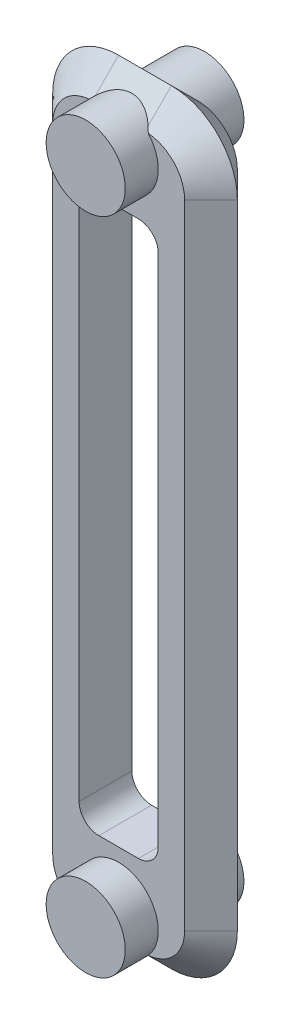
from build123d import *

# Parameters (mm, degrees)
EXTRUDE_1_DEPTH      = 20
EXTRUDE_1_DEPTH_BACK = 20
SKETCH_1_W           = 140
SKETCH_1_H           = 580
SKETCH_1_R           = 30
EXTRUDE_2_DEPTH      = 25
EXTRUDE_2_DEPTH_BACK = 65
SKETCH_3_R           = 30
CUT_EXTRUDE_1_DEPTH  = 40
FILLET_1_R           = 50
FILLET_2_R           = 15
CHAMFER_1_SIZE       = 20


with BuildPart() as part:
    # Эскиз1 → Бобышка-Вытянуть1 (new, two sides: drawn at the far end of the back side and taken through both)
    with BuildSketch(Plane.XY.offset(-EXTRUDE_1_DEPTH_BACK)):
        with Locations((0, -208.783389553)):
            Rectangle(SKETCH_1_W, SKETCH_1_H)
        with Locations((0, 41.216610447)):
            Circle(SKETCH_1_R, mode=Mode.SUBTRACT)
        with Locations((0, -458.783389553)):
            Circle(SKETCH_1_R, mode=Mode.SUBTRACT)
    extrude(amount=EXTRUDE_1_DEPTH + EXTRUDE_1_DEPTH_BACK)

    # Эскиз3 → Бобышка-Вытянуть2 (add, two sides: drawn at the far end of the back side and taken through both)
    with BuildSketch(Plane(origin=(0, 0, -20), x_dir=(-1, 0, 0), z_dir=(0, 0, -1)).offset(-EXTRUDE_2_DEPTH_BACK)):
        with Locations((0, 41.216610447)):
            Circle(SKETCH_3_R)
        with Locations((0, -458.783389553)):
            Circle(SKETCH_3_R)
    extrude(amount=EXTRUDE_2_DEPTH + EXTRUDE_2_DEPTH_BACK)

    # Эскиз4 → Вырез-Вытянуть1 (cut)
    with BuildSketch(Plane(origin=(0, 0, -20), x_dir=(-1, 0, 0), z_dir=(0, 0, -1))):
        Polygon((-30, 1.216610447), (0, 1.216610447), (30, 1.216610447), (30, -418.783389553), (0, -418.783389553), (-30, -418.783389553), align=None)
    extrude(amount=-CUT_EXTRUDE_1_DEPTH, mode=Mode.SUBTRACT)

    # Скругление1
    fillet_1_edges = [part.edges().sort_by_distance(p)[0] for p in [
        (70, -498.783389553, 0),
        (70, 81.216610447, 0),
        (-70, 81.216610447, 0),
        (-70, -498.783389553, 0),
    ]]
    fillet(fillet_1_edges, radius=FILLET_1_R)

    # Скругление2
    fillet_2_edges = [part.edges().sort_by_distance(p)[0] for p in [
        (30, 1.216610447, 0),
        (-30, 1.216610447, 0),
        (-30, -418.783389553, 0),
        (30, -418.783389553, 0),
    ]]
    fillet(fillet_2_edges, radius=FILLET_2_R)

    # Фаска1
    # the kernel refuses this chamfer: 20 mm, written as the material it takes off along each edge
    with BuildSketch(Plane(origin=(20, -498.783389553, -20), x_dir=(0, -0.0274958766105877, 0.9996219169112968), z_dir=(-1, 0, 0))) as chamfer_1_piece_1_section:
        Polygon((CHAMFER_1_SIZE * 0.999621916911, CHAMFER_1_SIZE * 0.0274958766106), (-CHAMFER_1_SIZE * 0.0274958766106, CHAMFER_1_SIZE * 0.999621916911), (0, 0), align=None)
    chamfer_1_piece_1 = extrude(amount=40, mode=Mode.PRIVATE)
    chamfer_1_piece_1 = chamfer_1_piece_1 - Plane(origin=(0, -458.783389553, -12.567480213), x_dir=(-1, 0, 0), z_dir=(0, 0, 1)) * Cylinder(30, 160, mode=Mode.PRIVATE)
    add(chamfer_1_piece_1, mode=Mode.SUBTRACT)
    with BuildSketch(Plane(origin=(-20, -448.783389553, -20), x_dir=(0, -1, 0), z_dir=(1, 0, 0))) as chamfer_1_piece_2_section:
        Polygon((50, -CHAMFER_1_SIZE), (50 - CHAMFER_1_SIZE, 0), (50, 0), align=None)
    chamfer_1_piece_2 = revolve(axis=Axis((-20, -448.783389553, -20), (0, 0, -1)), revolution_arc=90, mode=Mode.PRIVATE)
    chamfer_1_piece_2 = chamfer_1_piece_2 - Plane(origin=(0, -458.783389553, -13.088521936), x_dir=(-1, 0, 0), z_dir=(0, 0, 1)) * Cylinder(30, 200, mode=Mode.PRIVATE)
    add(chamfer_1_piece_2, mode=Mode.SUBTRACT)
    with BuildSketch(Plane(origin=(20, -448.783389553, -20), x_dir=(1, 0, 0), z_dir=(0, 1, 0))) as chamfer_1_piece_3_section:
        Polygon((50, -CHAMFER_1_SIZE), (50 - CHAMFER_1_SIZE, 0), (50, 0), align=None)
    chamfer_1_piece_3 = revolve(axis=Axis((20, -448.783389553, -20), (0, 0, -1)), revolution_arc=90, mode=Mode.PRIVATE)
    chamfer_1_piece_3 = chamfer_1_piece_3 - Plane(origin=(0, -458.783389553, -13.088521936), x_dir=(-1, 0, 0), z_dir=(0, 0, 1)) * Cylinder(30, 200, mode=Mode.PRIVATE)
    add(chamfer_1_piece_3, mode=Mode.SUBTRACT)
    with BuildSketch(Plane(origin=(-70, -448.783389553, -20), x_dir=(-0.027495876610586317, 0, 0.9996219169112968), z_dir=(0, 1, 0)), Plane(origin=(70, 31.216610447, -20), x_dir=(0.027495876610586317, 0, 0.9996219169112968), z_dir=(0, -1, 0)), Plane(origin=(70, 31.216610447, 20), x_dir=(-0.9996219169112968, 0, 0.027495876610586317), z_dir=(0, -1, 0)), Plane(origin=(-70, -448.783389553, 20), x_dir=(0.9996219169112968, 0, 0.027495876610586317), z_dir=(0, 1, 0))) as chamfer_1_piece_4:
        Polygon((CHAMFER_1_SIZE * 0.999621916911, CHAMFER_1_SIZE * 0.0274958766106), (-CHAMFER_1_SIZE * 0.0274958766106, CHAMFER_1_SIZE * 0.999621916911), (0, 0), align=None)
    extrude(amount=480, mode=Mode.SUBTRACT)
    with BuildSketch(Plane(origin=(-20, 31.216610447, -20), x_dir=(0, 1, 0), z_dir=(1, 0, 0))) as chamfer_1_piece_5_section:
        Polygon((50, CHAMFER_1_SIZE), (50 - CHAMFER_1_SIZE, 0), (50, 0), align=None)
    chamfer_1_piece_5 = revolve(axis=Axis((-20, 31.216610447, -20), (0, 0, 1)), revolution_arc=90, mode=Mode.PRIVATE)
    chamfer_1_piece_5 = chamfer_1_piece_5 - Plane(origin=(0, 41.216610447, -13.088521936), x_dir=(-1, 0, 0), z_dir=(0, 0, 1)) * Cylinder(30, 200, mode=Mode.PRIVATE)
    add(chamfer_1_piece_5, mode=Mode.SUBTRACT)
    with BuildSketch(Plane(origin=(20, 31.216610447, -20), x_dir=(1, 0, 0), z_dir=(0, -1, 0))) as chamfer_1_piece_6_section:
        Polygon((50, CHAMFER_1_SIZE), (50 - CHAMFER_1_SIZE, 0), (50, 0), align=None)
    chamfer_1_piece_6 = revolve(axis=Axis((20, 31.216610447, -20), (0, 0, 1)), revolution_arc=90, mode=Mode.PRIVATE)
    chamfer_1_piece_6 = chamfer_1_piece_6 - Plane(origin=(0, 41.216610447, -13.088521936), x_dir=(-1, 0, 0), z_dir=(0, 0, 1)) * Cylinder(30, 200, mode=Mode.PRIVATE)
    add(chamfer_1_piece_6, mode=Mode.SUBTRACT)
    with BuildSketch(Plane(origin=(-20, 81.216610447, -20), x_dir=(0, 0.027495876610586317, 0.9996219169112968), z_dir=(1, 0, 0))) as chamfer_1_piece_7_section:
        Polygon((CHAMFER_1_SIZE * 0.999621916911, CHAMFER_1_SIZE * 0.0274958766106), (-CHAMFER_1_SIZE * 0.0274958766106, CHAMFER_1_SIZE * 0.999621916911), (0, 0), align=None)
    chamfer_1_piece_7 = extrude(amount=40, mode=Mode.PRIVATE)
    chamfer_1_piece_7 = chamfer_1_piece_7 - Plane(origin=(0, 41.216610447, -12.567480213), x_dir=(-1, 0, 0), z_dir=(0, 0, 1)) * Cylinder(30, 160, mode=Mode.PRIVATE)
    add(chamfer_1_piece_7, mode=Mode.SUBTRACT)
    with BuildSketch(Plane(origin=(20, -498.783389553, 20), x_dir=(0, 0.9996219169112968, 0.027495876610586206), z_dir=(-1, 0, 0))) as chamfer_1_piece_8_section:
        Polygon((CHAMFER_1_SIZE * 0.999621916911, CHAMFER_1_SIZE * 0.0274958766106), (-CHAMFER_1_SIZE * 0.0274958766106, CHAMFER_1_SIZE * 0.999621916911), (0, 0), align=None)
    chamfer_1_piece_8 = extrude(amount=40, mode=Mode.PRIVATE)
    chamfer_1_piece_8 = chamfer_1_piece_8 - Plane(origin=(0, -458.783389553, 12.567480585), x_dir=(-1, 0, 0), z_dir=(0, 0, -1)) * Cylinder(30, 160, mode=Mode.PRIVATE)
    add(chamfer_1_piece_8, mode=Mode.SUBTRACT)
    with BuildSketch(Plane(origin=(20, -448.783389553, 20), x_dir=(1, 0, 0), z_dir=(0, 1, 0))) as chamfer_1_piece_9_section:
        Polygon((50 - CHAMFER_1_SIZE, 0), (50, CHAMFER_1_SIZE), (50, 0), align=None)
    chamfer_1_piece_9 = revolve(axis=Axis((20, -448.783389553, 20), (0, 0, -1)), revolution_arc=90, mode=Mode.PRIVATE)
    chamfer_1_piece_9 = chamfer_1_piece_9 - Plane(origin=(0, -458.783389553, 13.088521928), x_dir=(-1, 0, 0), z_dir=(0, 0, -1)) * Cylinder(30, 200, mode=Mode.PRIVATE)
    add(chamfer_1_piece_9, mode=Mode.SUBTRACT)
    with BuildSketch(Plane(origin=(-20, -448.783389553, 20), x_dir=(0, -1, 0), z_dir=(1, 0, 0))) as chamfer_1_piece_10_section:
        Polygon((50 - CHAMFER_1_SIZE, 0), (50, CHAMFER_1_SIZE), (50, 0), align=None)
    chamfer_1_piece_10 = revolve(axis=Axis((-20, -448.783389553, 20), (0, 0, -1)), revolution_arc=90, mode=Mode.PRIVATE)
    chamfer_1_piece_10 = chamfer_1_piece_10 - Plane(origin=(0, -458.783389553, 13.088521939), x_dir=(-1, 0, 0), z_dir=(0, 0, -1)) * Cylinder(30, 200, mode=Mode.PRIVATE)
    add(chamfer_1_piece_10, mode=Mode.SUBTRACT)
    with BuildSketch(Plane(origin=(20, 31.216610447, 20), x_dir=(1, 0, 0), z_dir=(0, -1, 0))) as chamfer_1_piece_11_section:
        Polygon((50 - CHAMFER_1_SIZE, 0), (50, -CHAMFER_1_SIZE), (50, 0), align=None)
    chamfer_1_piece_11 = revolve(axis=Axis((20, 31.216610447, 20), (0, 0, 1)), revolution_arc=90, mode=Mode.PRIVATE)
    chamfer_1_piece_11 = chamfer_1_piece_11 - Plane(origin=(0, 41.216610447, 13.088521931), x_dir=(-1, 0, 0), z_dir=(0, 0, -1)) * Cylinder(30, 200, mode=Mode.PRIVATE)
    add(chamfer_1_piece_11, mode=Mode.SUBTRACT)
    with BuildSketch(Plane(origin=(-20, 31.216610447, 20), x_dir=(0, 1, 0), z_dir=(1, 0, 0))) as chamfer_1_piece_12_section:
        Polygon((50 - CHAMFER_1_SIZE, 0), (50, -CHAMFER_1_SIZE), (50, 0), align=None)
    chamfer_1_piece_12 = revolve(axis=Axis((-20, 31.216610447, 20), (0, 0, 1)), revolution_arc=90, mode=Mode.PRIVATE)
    chamfer_1_piece_12 = chamfer_1_piece_12 - Plane(origin=(0, 41.216610447, 13.088521936), x_dir=(-1, 0, 0), z_dir=(0, 0, -1)) * Cylinder(30, 200, mode=Mode.PRIVATE)
    add(chamfer_1_piece_12, mode=Mode.SUBTRACT)
    with BuildSketch(Plane(origin=(-20, 81.216610447, 20), x_dir=(0, -0.9996219169112968, 0.027495876610586337), z_dir=(1, 0, 0))) as chamfer_1_piece_13_section:
        Polygon((CHAMFER_1_SIZE * 0.999621916911, CHAMFER_1_SIZE * 0.0274958766106), (-CHAMFER_1_SIZE * 0.0274958766106, CHAMFER_1_SIZE * 0.999621916911), (0, 0), align=None)
    chamfer_1_piece_13 = extrude(amount=40, mode=Mode.PRIVATE)
    chamfer_1_piece_13 = chamfer_1_piece_13 - Plane(origin=(0, 41.216610447, 12.567480585), x_dir=(-1, 0, 0), z_dir=(0, 0, -1)) * Cylinder(30, 160, mode=Mode.PRIVATE)
    add(chamfer_1_piece_13, mode=Mode.SUBTRACT)


solid = part.part
